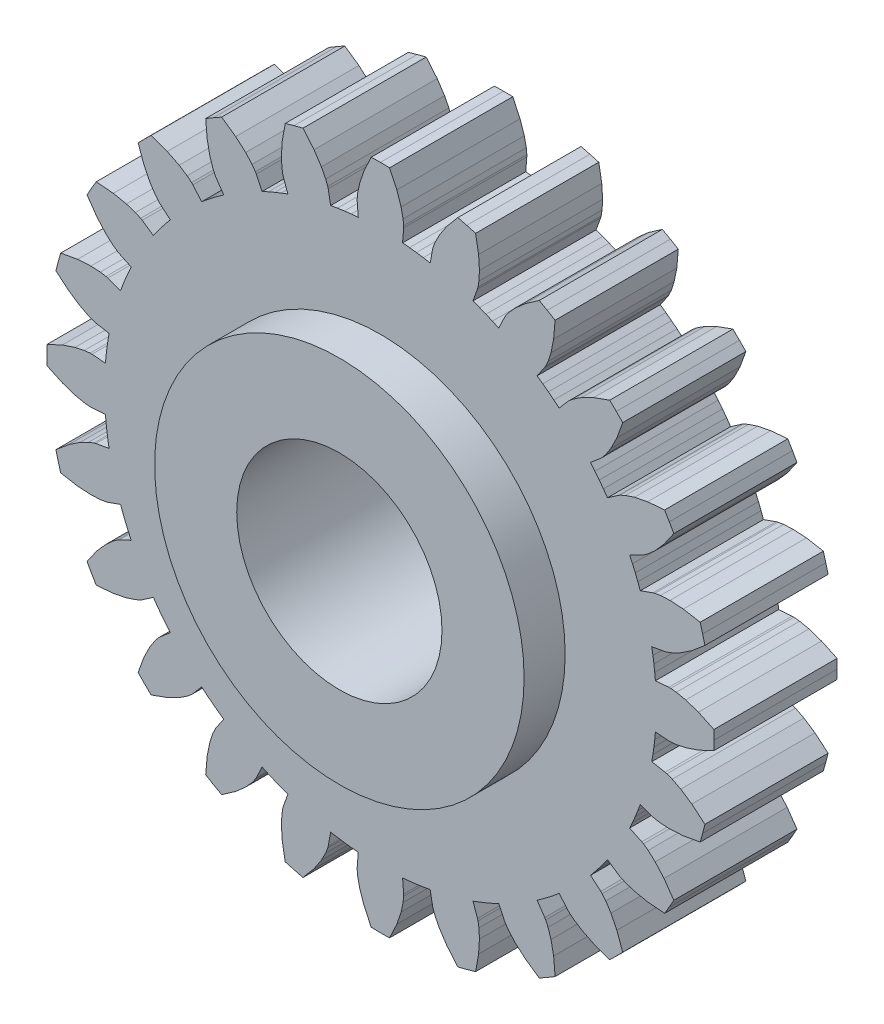
from build123d import *

# Parameters (mm, degrees)
SKETCH_1_R                         = 10
F_01_GEAR_BODY_Z24_M2_5_PA20_DEPTH = 6
SKETCH_2_R                         = 18
SKETCH_2_R_2                       = 10
F_02_HUB_D36_BORE_D20_DEPTH        = 10


with BuildPart() as part:
    # 草图1 → 01_GEAR_BODY_Z24_M2.5_PA20 (new, symmetric)
    with BuildSketch(Plane.XY):
        Polygon((26.788283392, -2.157196771), (28.099816439, -2.262811409), (28.285290163, -2.26352818), (28.838949201, -2.209028859), (29.745733832, -2.015469775), (30.976311775, -1.602282308), (32.487692786, -0.894325136), (32.5, 0), (32.487692786, 0.894325136), (30.976311775, 1.602282308), (29.745733832, 2.015469775), (28.838949201, 2.209028859), (28.285290163, 2.26352818), (28.099816439, 2.262811409), (26.788283392, 2.157196771), (26.725216411, 2.833448923), (26.645080649, 3.507891416), (26.547927289, 4.1800935), (26.433818379, 4.849625854), (27.727997101, 5.087059678), (27.907336475, 5.134371463), (28.428024576, 5.330311268), (29.253814493, 5.751968118), (30.335520724, 6.469573572), (31.612169876, 7.544581878), (31.392589354, 8.411618966), (31.149233121, 9.27228537), (29.50611837, 9.564945297), (28.210530568, 9.645556734), (27.284547096, 9.597827319), (26.73564807, 9.507172118), (26.556679725, 9.458475639), (25.317171162, 9.017010001), (25.0812262, 9.653896484), (24.829262436, 10.284617245), (24.561440795, 10.908769458), (24.277932327, 11.525954491), (25.466560583, 12.090256055), (25.627543925, 12.182372176), (26.079777056, 12.506399491), (26.76829604, 13.12741889), (27.627414067, 14.100538705), (28.582329831, 15.469338106), (28.145825623, 16.25), (27.688004695, 17.01835468), (26.025131759, 16.875773071), (24.752826265, 16.618314942), (23.870748197, 16.33254971), (23.364015745, 16.102917987), (23.203749174, 16.009560384), (22.120735556, 15.262328901), (21.727991872, 15.816446953), (21.32137102, 16.360463405), (20.9011327, 16.894030805), (20.467545308, 17.416808378), (21.469620046, 18.269521462), (21.601276608, 18.400164357), (21.954235828, 18.830197256), (22.458562449, 19.608257759), (23.036544798, 20.770575427), (23.604651242, 22.339884506), (22.980970389, 22.980970389), (22.339884506, 23.604651242), (20.770575427, 23.036544798), (19.608257759, 22.458562449), (18.830197256, 21.954235828), (18.400164357, 21.601276608), (18.269521462, 21.469620046), (17.416808378, 20.467545308), (16.894030805, 20.9011327), (16.360463405, 21.32137102), (15.816446953, 21.727991872), (15.262328901, 22.120735556), (16.009560384, 23.203749174), (16.102917987, 23.364015745), (16.33254971, 23.870748197), (16.618314942, 24.752826265), (16.875773071, 26.025131759), (17.01835468, 27.688004695), (16.25, 28.145825623), (15.469338106, 28.582329831), (14.100538705, 27.627414067), (13.12741889, 26.76829604), (12.506399491, 26.079777056), (12.182372176, 25.627543925), (12.090256055, 25.466560583), (11.525954491, 24.277932327), (10.908769458, 24.561440795), (10.284617245, 24.829262436), (9.653896484, 25.0812262), (9.017010001, 25.317171162), (9.458475639, 26.556679725), (9.507172118, 26.73564807), (9.597827319, 27.284547096), (9.645556734, 28.210530568), (9.564945297, 29.50611837), (9.27228537, 31.149233121), (8.411618966, 31.392589354), (7.544581878, 31.612169876), (6.469573572, 30.335520724), (5.751968118, 29.253814493), (5.330311268, 28.428024576), (5.134371463, 27.907336475), (5.087059678, 27.727997101), (4.849625854, 26.433818379), (4.1800935, 26.547927289), (3.507891416, 26.645080649), (2.833448923, 26.725216411), (2.157196771, 26.788283392), (2.262811409, 28.099816439), (2.26352818, 28.285290163), (2.209028859, 28.838949201), (2.015469775, 29.745733832), (1.602282308, 30.976311775), (0.894325136, 32.487692786), (0, 32.5), (-0.894325136, 32.487692786), (-1.602282308, 30.976311775), (-2.015469775, 29.745733832), (-2.209028859, 28.838949201), (-2.26352818, 28.285290163), (-2.262811409, 28.099816439), (-2.157196771, 26.788283392), (-2.833448923, 26.725216411), (-3.507891416, 26.645080649), (-4.1800935, 26.547927289), (-4.849625854, 26.433818379), (-5.087059678, 27.727997101), (-5.134371463, 27.907336475), (-5.330311268, 28.428024576), (-5.751968118, 29.253814493), (-6.469573572, 30.335520724), (-7.544581878, 31.612169876), (-8.411618966, 31.392589354), (-9.27228537, 31.149233121), (-9.564945297, 29.50611837), (-9.645556734, 28.210530568), (-9.597827319, 27.284547096), (-9.507172118, 26.73564807), (-9.458475639, 26.556679725), (-9.017010001, 25.317171162), (-9.653896484, 25.0812262), (-10.284617245, 24.829262436), (-10.908769458, 24.561440795), (-11.525954491, 24.277932327), (-12.090256055, 25.466560583), (-12.182372176, 25.627543925), (-12.506399491, 26.079777056), (-13.12741889, 26.76829604), (-14.100538705, 27.627414067), (-15.469338106, 28.582329831), (-16.25, 28.145825623), (-17.01835468, 27.688004695), (-16.875773071, 26.025131759), (-16.618314942, 24.752826265), (-16.33254971, 23.870748197), (-16.102917987, 23.364015745), (-16.009560384, 23.203749174), (-15.262328901, 22.120735556), (-15.816446953, 21.727991872), (-16.360463405, 21.32137102), (-16.894030805, 20.9011327), (-17.416808378, 20.467545308), (-18.269521462, 21.469620046), (-18.400164357, 21.601276608), (-18.830197256, 21.954235828), (-19.608257759, 22.458562449), (-20.770575427, 23.036544798), (-22.339884506, 23.604651242), (-22.980970389, 22.980970389), (-23.604651242, 22.339884506), (-23.036544798, 20.770575427), (-22.458562449, 19.608257759), (-21.954235828, 18.830197256), (-21.601276608, 18.400164357), (-21.469620046, 18.269521462), (-20.467545308, 17.416808378), (-20.9011327, 16.894030805), (-21.32137102, 16.360463405), (-21.727991872, 15.816446953), (-22.120735556, 15.262328901), (-23.203749174, 16.009560384), (-23.364015745, 16.102917987), (-23.870748197, 16.33254971), (-24.752826265, 16.618314942), (-26.025131759, 16.875773071), (-27.688004695, 17.01835468), (-28.145825623, 16.25), (-28.582329831, 15.469338106), (-27.627414067, 14.100538705), (-26.76829604, 13.12741889), (-26.079777056, 12.506399491), (-25.627543925, 12.182372176), (-25.466560583, 12.090256055), (-24.277932327, 11.525954491), (-24.561440795, 10.908769458), (-24.829262436, 10.284617245), (-25.0812262, 9.653896484), (-25.317171162, 9.017010001), (-26.556679725, 9.458475639), (-26.73564807, 9.507172118), (-27.284547096, 9.597827319), (-28.210530568, 9.645556734), (-29.50611837, 9.564945297), (-31.149233121, 9.27228537), (-31.392589354, 8.411618966), (-31.612169876, 7.544581878), (-30.335520724, 6.469573572), (-29.253814493, 5.751968118), (-28.428024576, 5.330311268), (-27.907336475, 5.134371463), (-27.727997101, 5.087059678), (-26.433818379, 4.849625854), (-26.547927289, 4.1800935), (-26.645080649, 3.507891416), (-26.725216411, 2.833448923), (-26.788283392, 2.157196771), (-28.099816439, 2.262811409), (-28.285290163, 2.26352818), (-28.838949201, 2.209028859), (-29.745733832, 2.015469775), (-30.976311775, 1.602282308), (-32.487692786, 0.894325136), (-32.5, 0), (-32.487692786, -0.894325136), (-30.976311775, -1.602282308), (-29.745733832, -2.015469775), (-28.838949201, -2.209028859), (-28.285290163, -2.26352818), (-28.099816439, -2.262811409), (-26.788283392, -2.157196771), (-26.725216411, -2.833448923), (-26.645080649, -3.507891416), (-26.547927289, -4.1800935), (-26.433818379, -4.849625854), (-27.727997101, -5.087059678), (-27.907336475, -5.134371463), (-28.428024576, -5.330311268), (-29.253814493, -5.751968118), (-30.335520724, -6.469573572), (-31.612169876, -7.544581878), (-31.392589354, -8.411618966), (-31.149233121, -9.27228537), (-29.50611837, -9.564945297), (-28.210530568, -9.645556734), (-27.284547096, -9.597827319), (-26.73564807, -9.507172118), (-26.556679725, -9.458475639), (-25.317171162, -9.017010001), (-25.0812262, -9.653896484), (-24.829262436, -10.284617245), (-24.561440795, -10.908769458), (-24.277932327, -11.525954491), (-25.466560583, -12.090256055), (-25.627543925, -12.182372176), (-26.079777056, -12.506399491), (-26.76829604, -13.12741889), (-27.627414067, -14.100538705), (-28.582329831, -15.469338106), (-28.145825623, -16.25), (-27.688004695, -17.01835468), (-26.025131759, -16.875773071), (-24.752826265, -16.618314942), (-23.870748197, -16.33254971), (-23.364015745, -16.102917987), (-23.203749174, -16.009560384), (-22.120735556, -15.262328901), (-21.727991872, -15.816446953), (-21.32137102, -16.360463405), (-20.9011327, -16.894030805), (-20.467545308, -17.416808378), (-21.469620046, -18.269521462), (-21.601276608, -18.400164357), (-21.954235828, -18.830197256), (-22.458562449, -19.608257759), (-23.036544798, -20.770575427), (-23.604651242, -22.339884506), (-22.980970389, -22.980970389), (-22.339884506, -23.604651242), (-20.770575427, -23.036544798), (-19.608257759, -22.458562449), (-18.830197256, -21.954235828), (-18.400164357, -21.601276608), (-18.269521462, -21.469620046), (-17.416808378, -20.467545308), (-16.894030805, -20.9011327), (-16.360463405, -21.32137102), (-15.816446953, -21.727991872), (-15.262328901, -22.120735556), (-16.009560384, -23.203749174), (-16.102917987, -23.364015745), (-16.33254971, -23.870748197), (-16.618314942, -24.752826265), (-16.875773071, -26.025131759), (-17.01835468, -27.688004695), (-16.25, -28.145825623), (-15.469338106, -28.582329831), (-14.100538705, -27.627414067), (-13.12741889, -26.76829604), (-12.506399491, -26.079777056), (-12.182372176, -25.627543925), (-12.090256055, -25.466560583), (-11.525954491, -24.277932327), (-10.908769458, -24.561440795), (-10.284617245, -24.829262436), (-9.653896484, -25.0812262), (-9.017010001, -25.317171162), (-9.458475639, -26.556679725), (-9.507172118, -26.73564807), (-9.597827319, -27.284547096), (-9.645556734, -28.210530568), (-9.564945297, -29.50611837), (-9.27228537, -31.149233121), (-8.411618966, -31.392589354), (-7.544581878, -31.612169876), (-6.469573572, -30.335520724), (-5.751968118, -29.253814493), (-5.330311268, -28.428024576), (-5.134371463, -27.907336475), (-5.087059678, -27.727997101), (-4.849625854, -26.433818379), (-4.1800935, -26.547927289), (-3.507891416, -26.645080649), (-2.833448923, -26.725216411), (-2.157196771, -26.788283392), (-2.262811409, -28.099816439), (-2.26352818, -28.285290163), (-2.209028859, -28.838949201), (-2.015469775, -29.745733832), (-1.602282308, -30.976311775), (-0.894325136, -32.487692786), (0, -32.5), (0.894325136, -32.487692786), (1.602282308, -30.976311775), (2.015469775, -29.745733832), (2.209028859, -28.838949201), (2.26352818, -28.285290163), (2.262811409, -28.099816439), (2.157196771, -26.788283392), (2.833448923, -26.725216411), (3.507891416, -26.645080649), (4.1800935, -26.547927289), (4.849625854, -26.433818379), (5.087059678, -27.727997101), (5.134371463, -27.907336475), (5.330311268, -28.428024576), (5.751968118, -29.253814493), (6.469573572, -30.335520724), (7.544581878, -31.612169876), (8.411618966, -31.392589354), (9.27228537, -31.149233121), (9.564945297, -29.50611837), (9.645556734, -28.210530568), (9.597827319, -27.284547096), (9.507172118, -26.73564807), (9.458475639, -26.556679725), (9.017010001, -25.317171162), (9.653896484, -25.0812262), (10.284617245, -24.829262436), (10.908769458, -24.561440795), (11.525954491, -24.277932327), (12.090256055, -25.466560583), (12.182372176, -25.627543925), (12.506399491, -26.079777056), (13.12741889, -26.76829604), (14.100538705, -27.627414067), (15.469338106, -28.582329831), (16.25, -28.145825623), (17.01835468, -27.688004695), (16.875773071, -26.025131759), (16.618314942, -24.752826265), (16.33254971, -23.870748197), (16.102917987, -23.364015745), (16.009560384, -23.203749174), (15.262328901, -22.120735556), (15.816446953, -21.727991872), (16.360463405, -21.32137102), (16.894030805, -20.9011327), (17.416808378, -20.467545308), (18.269521462, -21.469620046), (18.400164357, -21.601276608), (18.830197256, -21.954235828), (19.608257759, -22.458562449), (20.770575427, -23.036544798), (22.339884506, -23.604651242), (22.980970389, -22.980970389), (23.604651242, -22.339884506), (23.036544798, -20.770575427), (22.458562449, -19.608257759), (21.954235828, -18.830197256), (21.601276608, -18.400164357), (21.469620046, -18.269521462), (20.467545308, -17.416808378), (20.9011327, -16.894030805), (21.32137102, -16.360463405), (21.727991872, -15.816446953), (22.120735556, -15.262328901), (23.203749174, -16.009560384), (23.364015745, -16.102917987), (23.870748197, -16.33254971), (24.752826265, -16.618314942), (26.025131759, -16.875773071), (27.688004695, -17.01835468), (28.145825623, -16.25), (28.582329831, -15.469338106), (27.627414067, -14.100538705), (26.76829604, -13.12741889), (26.079777056, -12.506399491), (25.627543925, -12.182372176), (25.466560583, -12.090256055), (24.277932327, -11.525954491), (24.561440795, -10.908769458), (24.829262436, -10.284617245), (25.0812262, -9.653896484), (25.317171162, -9.017010001), (26.556679725, -9.458475639), (26.73564807, -9.507172118), (27.284547096, -9.597827319), (28.210530568, -9.645556734), (29.50611837, -9.564945297), (31.149233121, -9.27228537), (31.392589354, -8.411618966), (31.612169876, -7.544581878), (30.335520724, -6.469573572), (29.253814493, -5.751968118), (28.428024576, -5.330311268), (27.907336475, -5.134371463), (27.727997101, -5.087059678), (26.433818379, -4.849625854), (26.547927289, -4.1800935), (26.645080649, -3.507891416), (26.725216411, -2.833448923), align=None)
        Circle(SKETCH_1_R, mode=Mode.SUBTRACT)
    extrude(amount=F_01_GEAR_BODY_Z24_M2_5_PA20_DEPTH, both=True)

    # 草图2 → 02_HUB_D36_BORE_D20 (add, symmetric)
    with BuildSketch(Plane.XY):
        Circle(SKETCH_2_R)
        Circle(SKETCH_2_R_2, mode=Mode.SUBTRACT)
    extrude(amount=F_02_HUB_D36_BORE_D20_DEPTH, both=True)


solid = part.part
